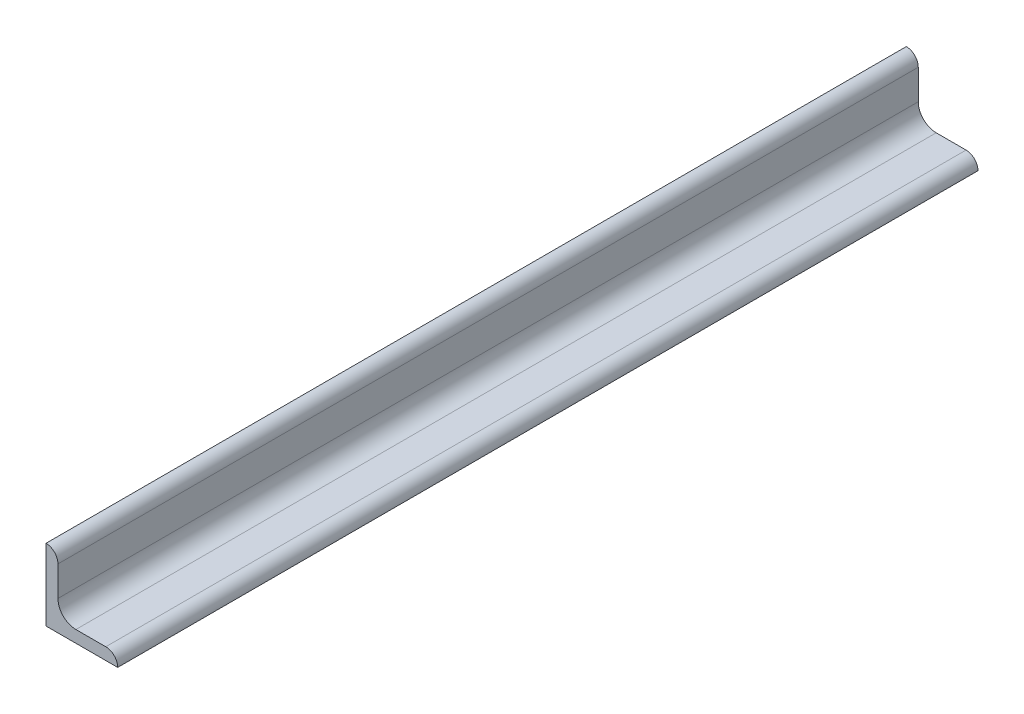
from build123d import *

# Parameters (mm, degrees)
BASESTEELANGLE_DEPTH = 114.3


with BuildPart() as part:
    # Sketch1 → BaseSteelAngle (new, symmetric)
    with BuildSketch(Plane.XY):
        with BuildLine():
            Line((0, 0), (0, 19.05))
            Line((0, 19.05), (0.00508, 19.05))
            ThreePointArc((0.00508, 19.05), (2.246551928, 18.121551928), (3.175, 15.88008))
            Line((3.175, 15.88008), (3.175, 7.9375))
            ThreePointArc((3.175, 7.9375), (4.569903955, 4.569903955), (7.9375, 3.175))
            Line((7.9375, 3.175), (15.88008, 3.175))
            ThreePointArc((15.88008, 3.175), (18.121551928, 2.246551928), (19.05, 0.00508))
            Line((19.05, 0.00508), (19.05, 0))
            Line((19.05, 0), (0, 0))
        make_face()
    extrude(amount=BASESTEELANGLE_DEPTH, both=True)


solid = part.part
